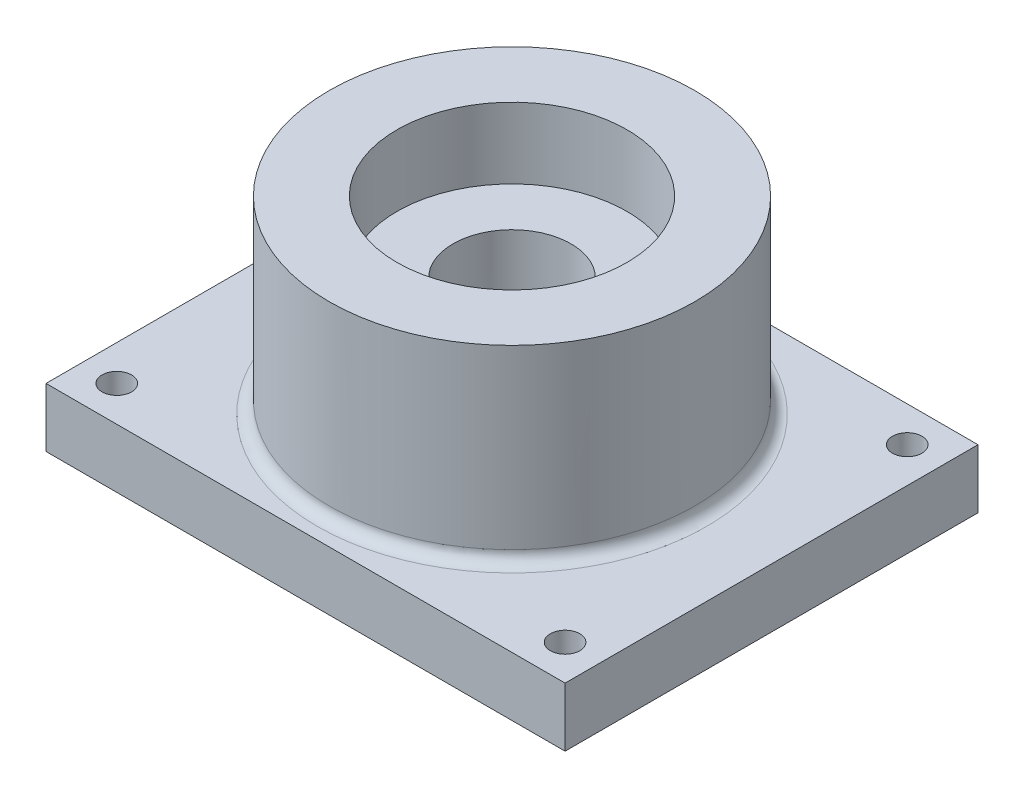
from build123d import *

# Parameters (mm, degrees)
SKETCH1_R           = 15.5
BOSS_EXTRUDE1_DEPTH = 16
SKETCH16_W          = 44
SKETCH16_H          = 35
SKETCH16_R          = 1.25
BOSS_EXTRUDE6_DEPTH = 5
SKETCH17_R          = 9.75
CUT_EXTRUDE5_DEPTH  = 6
SKETCH18_R          = 5
CUT_EXTRUDE7_DEPTH  = 19
FILLET4_R           = 1


with BuildPart() as part:
    # Sketch1 → Boss-Extrude1 (new body)
    with BuildSketch(Plane(origin=(0, 0, 0), x_dir=(1, 0, 0), z_dir=(0, 1, 0))):
        Circle(SKETCH1_R)
    extrude(amount=BOSS_EXTRUDE1_DEPTH)

    # Sketch16 → Boss-Extrude6 (add)
    with BuildSketch(Plane.XZ):
        Rectangle(SKETCH16_W, SKETCH16_H)
        with Locations((-19, 14.5)):
            Circle(SKETCH16_R, mode=Mode.SUBTRACT)
        with Locations((19, 14.5)):
            Circle(SKETCH16_R, mode=Mode.SUBTRACT)
        with Locations((19, -14.5)):
            Circle(SKETCH16_R, mode=Mode.SUBTRACT)
        with Locations((-19, -14.5)):
            Circle(SKETCH16_R, mode=Mode.SUBTRACT)
    extrude(amount=BOSS_EXTRUDE6_DEPTH)

    # Sketch17 → Cut-Extrude5 (cut)
    with BuildSketch(Plane(origin=(0, 16, 0), x_dir=(1, 0, 0), z_dir=(0, 1, 0))):
        Circle(SKETCH17_R)
    extrude(amount=-CUT_EXTRUDE5_DEPTH, mode=Mode.SUBTRACT)

    # Sketch18 → Cut-Extrude7 (cut)
    with BuildSketch(Plane(origin=(0, 10, 0), x_dir=(1, 0, 0), z_dir=(0, 1, 0))):
        Circle(SKETCH18_R)
    extrude(amount=-CUT_EXTRUDE7_DEPTH, mode=Mode.SUBTRACT)

    # Fillet4
    fillet4_edges = [part.edges().sort_by_distance(p)[0] for p in [
        (-15.5, 0, 0),
    ]]
    fillet(fillet4_edges, radius=FILLET4_R)


solid = part.part
